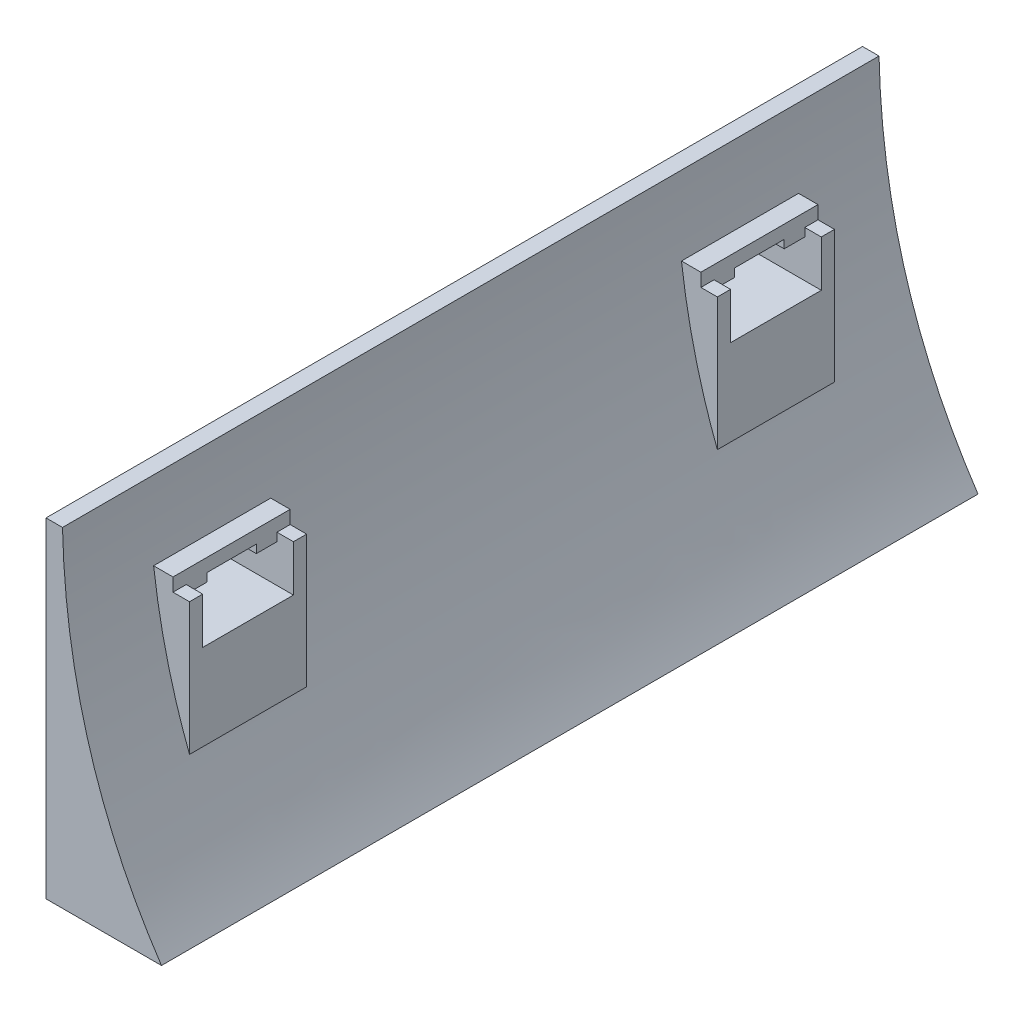
from build123d import *

# Parameters (mm, degrees)
SKETCH1_W                = 14
SKETCH1_H                = 99
BOSS_EXTRUDE1_DEPTH      = 40
CUT_EXTRUDE1_DEPTH       = 108.689368092
SKETCH3_W                = 6
SKETCH3_H                = 5
BOSS_EXTRUDE2_DEPTH      = 6
SKETCH4_R                = 1
CUT_EXTRUDE2_DEPTH       = 6
SKETCH5_R                = 1
CUT_EXTRUDE3_DEPTH       = 6
FILLET1_R                = 2
SKETCH6_W                = 6
SKETCH6_H                = 5
BOSS_EXTRUDE3_DEPTH      = 6
SKETCH7_R                = 1
CUT_EXTRUDE4_DEPTH       = 5
SKETCH8_R                = 1
CUT_EXTRUDE5_DEPTH       = 5
FILLET2_R                = 2
SKETCH9_W                = 11
SKETCH9_H                = 5.6
CUT_EXTRUDE6_DEPTH       = 10
BOSS_EXTRUDE4_DEPTH      = 4
BOSS_EXTRUDE4_DEPTH_BACK = 7
FILLET4_R                = 4
SKETCH11_W               = 14.2
SKETCH11_H               = 1.6
BOSS_EXTRUDE5_DEPTH      = 5
SKETCH12_W               = 2
SKETCH12_H               = 2.5
BOSS_EXTRUDE6_DEPTH      = 1
SKETCH13_W               = 2
SKETCH13_H               = 2.5
BOSS_EXTRUDE7_DEPTH      = 1
BOSS_EXTRUDE8_DEPTH      = 10
BOSS_EXTRUDE9_DEPTH      = 10


with BuildPart() as part:
    # Sketch1 → Boss-Extrude1 (new body)
    with BuildSketch(Plane(origin=(0, 0, 0), x_dir=(1, 0, 0), z_dir=(0, 1, 0))):
        with Locations((7, 49.5)):
            Rectangle(SKETCH1_W, SKETCH1_H)
    extrude(amount=BOSS_EXTRUDE1_DEPTH)

    # Sketch2 → Cut-Extrude1 (cut, through all)
    with BuildSketch(Plane.XY):
        with BuildLine():
            Line((14, 0), (14, 40))
            Line((14, 40), (2, 40))
            add(Edge.make_bspline(
                [(2, 40), (2.539521764, 17.05373231), (14, 0)],
                knots=[0, 0, 0, 0.735735095, 0.735735095, 0.735735095], degree=2))
        make_face()
    extrude(amount=-CUT_EXTRUDE1_DEPTH, mode=Mode.SUBTRACT)

    # Sketch3 → Boss-Extrude2 (add)
    with BuildSketch(Plane.ZY):
        with Locations((-84.5, 10)):
            Rectangle(SKETCH3_W, SKETCH3_H)
        with Locations((-14.5, 10)):
            Rectangle(SKETCH3_W, SKETCH3_H)
    extrude(amount=BOSS_EXTRUDE2_DEPTH)

    # Sketch4 → Cut-Extrude2 (cut)
    with BuildSketch(Plane.XZ.offset(-7.5)):
        with Locations(Location((-3, -84.5, 0), (0, 0, 270))):
            Circle(SKETCH4_R)
    extrude(amount=-CUT_EXTRUDE2_DEPTH, mode=Mode.SUBTRACT)

    # Sketch5 → Cut-Extrude3 (cut)
    with BuildSketch(Plane.XZ.offset(-7.5)):
        with Locations(Location((-3, -14.5, 0), (0, 0, 270))):
            Circle(SKETCH5_R)
    extrude(amount=-CUT_EXTRUDE3_DEPTH, mode=Mode.SUBTRACT)

    # Fillet1
    fillet1_edges = [part.edges().sort_by_distance(p)[0] for p in [
        (0, 10, -81.5),
        (0, 10, -87.5),
        (-6, 10, -81.5),
        (-6, 10, -87.5),
        (0, 10, -17.5),
        (0, 10, -11.5),
        (-6, 10, -17.5),
        (-6, 10, -11.5),
    ]]
    fillet(fillet1_edges, radius=FILLET1_R)

    # Sketch6 → Boss-Extrude3 (add)
    with BuildSketch(Plane.ZY):
        with Locations((-69.5, 27)):
            Rectangle(SKETCH6_W, SKETCH6_H)
        with Locations((-29.5, 27)):
            Rectangle(SKETCH6_W, SKETCH6_H)
    extrude(amount=BOSS_EXTRUDE3_DEPTH)

    # Sketch7 → Cut-Extrude4 (cut)
    with BuildSketch(Plane(origin=(0, 29.5, 0), x_dir=(1, 0, 0), z_dir=(0, 1, 0))):
        with Locations(Location((-3, 69.5, 0), (0, 0, 270))):
            Circle(SKETCH7_R)
    extrude(amount=-CUT_EXTRUDE4_DEPTH, mode=Mode.SUBTRACT)

    # Sketch8 → Cut-Extrude5 (cut)
    with BuildSketch(Plane(origin=(0, 29.5, 0), x_dir=(1, 0, 0), z_dir=(0, 1, 0))):
        with Locations(Location((-3, 29.5, 0), (0, 0, 270))):
            Circle(SKETCH8_R)
    extrude(amount=-CUT_EXTRUDE5_DEPTH, mode=Mode.SUBTRACT)

    # Fillet2
    fillet2_edges = [part.edges().sort_by_distance(p)[0] for p in [
        (0, 27, -66.5),
        (0, 27, -72.5),
        (-6, 27, -66.5),
        (-6, 27, -72.5),
        (0, 27, -32.5),
        (0, 27, -26.5),
        (-6, 27, -32.5),
        (-6, 27, -26.5),
    ]]
    fillet(fillet2_edges, radius=FILLET2_R)

    # Sketch9 → Cut-Extrude6 (cut)
    with BuildSketch(Plane.ZY):
        with Locations((-81.5, 26.7)):
            Rectangle(SKETCH9_W, SKETCH9_H)
        with Locations((-17.5, 26.7)):
            Rectangle(SKETCH9_W, SKETCH9_H)
    extrude(amount=-CUT_EXTRUDE6_DEPTH, mode=Mode.SUBTRACT)

    # Sketch10 → Boss-Extrude4 (add, two sides: drawn at the far end of the back side and taken through both)
    with BuildSketch(Plane.ZY.offset(-BOSS_EXTRUDE4_DEPTH_BACK)):
        Polygon((-76, 29.5), (-74.4, 29.5), (-74.4, 22.3), (-76, 22.3), (-88.6, 22.3), (-88.6, 29.5), (-87, 29.5), (-87, 23.9), (-76, 23.9), align=None)
        Polygon((-23, 29.5), (-24.6, 29.5), (-24.6, 22.3), (-23, 22.3), (-10.4, 22.3), (-10.4, 29.5), (-12, 29.5), (-12, 23.9), (-23, 23.9), align=None)
    extrude(amount=BOSS_EXTRUDE4_DEPTH + BOSS_EXTRUDE4_DEPTH_BACK)

    # Fillet4
    fillet4_edges = [part.edges().sort_by_distance(p)[0] for p in [
        (0, 22.3, -81.5),
        (0, 22.3, -17.5),
    ]]
    fillet(fillet4_edges, radius=FILLET4_R - 0.0001)  # a hair under: the kernel refuses the full size

    # Sketch11 → Boss-Extrude5 (add)
    with BuildSketch(Plane.ZY):
        with Locations((-81.5, 30.3)):
            Rectangle(SKETCH11_W, SKETCH11_H)
        with Locations((-17.5, 30.3)):
            Rectangle(SKETCH11_W, SKETCH11_H)
    extrude(amount=-BOSS_EXTRUDE5_DEPTH)

    # Sketch12 → Boss-Extrude6 (add)
    with BuildSketch(Plane.XZ.offset(-29.5)):
        with Locations((4, -77.25)):
            Rectangle(SKETCH12_W, SKETCH12_H)
        with Locations((4, -85.75)):
            Rectangle(SKETCH12_W, SKETCH12_H)
    extrude(amount=BOSS_EXTRUDE6_DEPTH)

    # Sketch13 → Boss-Extrude7 (add)
    with BuildSketch(Plane.XZ.offset(-29.5)):
        with Locations((4, -13.25)):
            Rectangle(SKETCH13_W, SKETCH13_H)
        with Locations((4, -21.75)):
            Rectangle(SKETCH13_W, SKETCH13_H)
    extrude(amount=BOSS_EXTRUDE7_DEPTH)

    # Sketch14 → Boss-Extrude8 (add)
    with BuildSketch(Plane.XZ.offset(-22.3)):
        Polygon((4.247690058, -10.4), (7, -10.4), (7, -24.6), (4.247690059, -24.6), align=None)
    extrude(amount=BOSS_EXTRUDE8_DEPTH)

    # Sketch15 → Boss-Extrude9 (add)
    with BuildSketch(Plane.XZ.offset(-22.3)):
        Polygon((4.247690058, -74.4), (4.247690059, -88.6), (7, -88.6), (7, -74.4), align=None)
    extrude(amount=BOSS_EXTRUDE9_DEPTH)


solid = part.part
